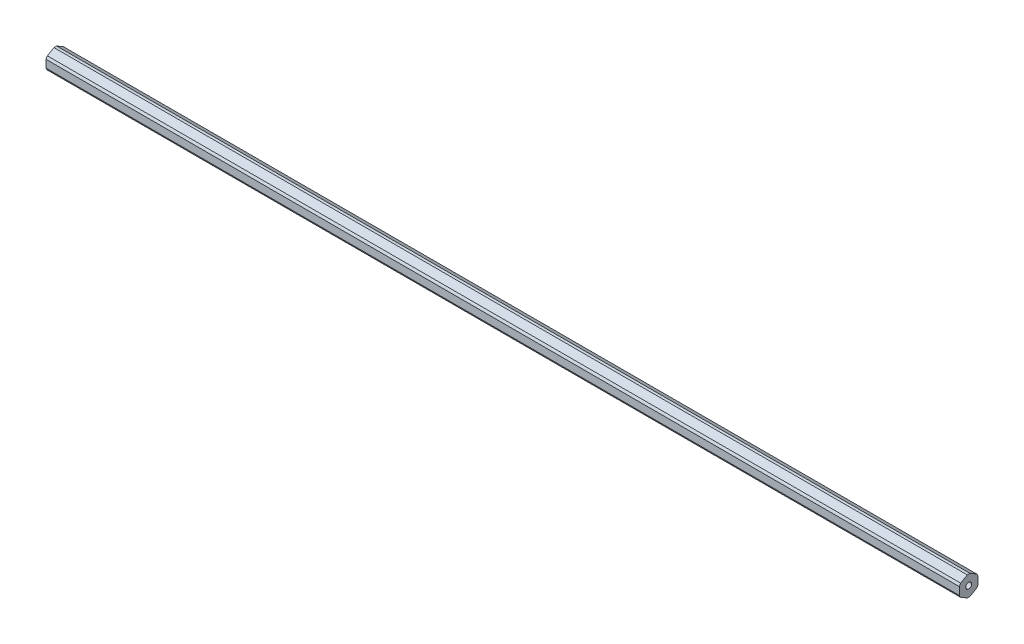
from build123d import *

# Parameters (mm, degrees)
SKETCH1_R           = 1.9939
BOSS_EXTRUDE1_DEPTH = 311.15


with BuildPart() as part:
    # Sketch1 → Boss-Extrude1 (new, symmetric)
    with BuildSketch(Plane(origin=(914.4, 0, 0), x_dir=(0, 0, -1), z_dir=(1, 0, 0))):
        with BuildLine():
            Line((-5.43426841, -4.194872089), (-0.91573159, -6.803650539))
            ThreePointArc((-0.91573159, -6.803650539), (0, -6.865), (0.91573159, -6.803650539))
            Line((0.91573159, -6.803650539), (5.43426841, -4.194872089))
            ThreePointArc((5.43426841, -4.194872089), (5.945264397, -3.4325), (6.35, -2.60877845))
            Line((6.35, -2.60877845), (6.35, 2.60877845))
            ThreePointArc((6.35, 2.60877845), (5.945264397, 3.4325), (5.43426841, 4.194872089))
            Line((5.43426841, 4.194872089), (0.91573159, 6.803650539))
            ThreePointArc((0.91573159, 6.803650539), (0, 6.865), (-0.91573159, 6.803650539))
            Line((-0.91573159, 6.803650539), (-5.43426841, 4.194872089))
            ThreePointArc((-5.43426841, 4.194872089), (-5.945264397, 3.4325), (-6.35, 2.60877845))
            Line((-6.35, 2.60877845), (-6.35, -2.60877845))
            ThreePointArc((-6.35, -2.60877845), (-5.945264397, -3.4325), (-5.43426841, -4.194872089))
        make_face()
        Circle(SKETCH1_R, mode=Mode.SUBTRACT)
    extrude(amount=BOSS_EXTRUDE1_DEPTH, both=True)


solid = part.part
